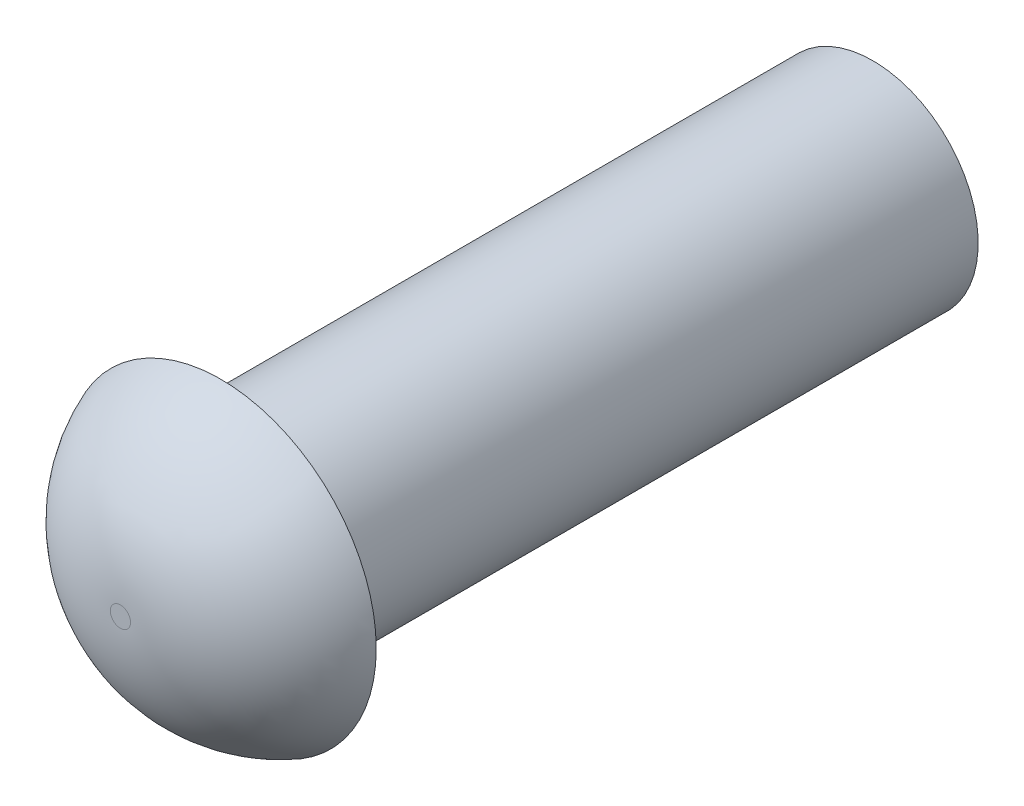
from build123d import *

# Parameters (mm, degrees)
SZKIC1_R                    = 1.05
DODANIE_WYCI_GNI_CIE1_DEPTH = 6.5
SZKIC2_R                    = 1.55
DODANIE_WYCI_GNI_CIE2_DEPTH = 1
ZAOKR_GLENIE1_R             = 1.55


with BuildPart() as part:
    # Szkic1 → Dodanie-wyciągnięcie1 (new body)
    with BuildSketch(Plane.XY):
        with Locations(Location((0, 0, 0), (0, 0, 180))):
            Circle(SZKIC1_R)
    extrude(amount=DODANIE_WYCI_GNI_CIE1_DEPTH)

    # Szkic2 → Dodanie-wyciągnięcie2 (add)
    with BuildSketch(Plane.XY.offset(6.5)):
        Circle(SZKIC2_R)
    extrude(amount=DODANIE_WYCI_GNI_CIE2_DEPTH)

    # Zaokrąglenie1
    # the kernel refuses this fillet: 1.55 mm, written as the material it takes off along each edge
    with BuildSketch(Plane(origin=(0, 0, 7.5), x_dir=(1, 0, 0), z_dir=(0, -1, 0))) as zaokr_glenie1_piece_1:
        with BuildLine():
            CenterArc((0.100862325, -1.55), ZAOKR_GLENIE1_R, 20.783559596, 69.216440404)
            Line((0.100862325, 0), (0.100862325, 0.031))
            Line((0.100862325, 0.031), (1.55, 0.031))
            Line((1.55, 0.031), (1.581, 0))
            ThreePointArc((1.581, 0), (1.581, -0.5), (1.578982753, -0.989))
            Line((1.578982753, -0.989), (1.55, -1))
        make_face()
    revolve(axis=Axis((0, 0, 7.5), (0, 0, 1)), mode=Mode.SUBTRACT)


solid = part.part
